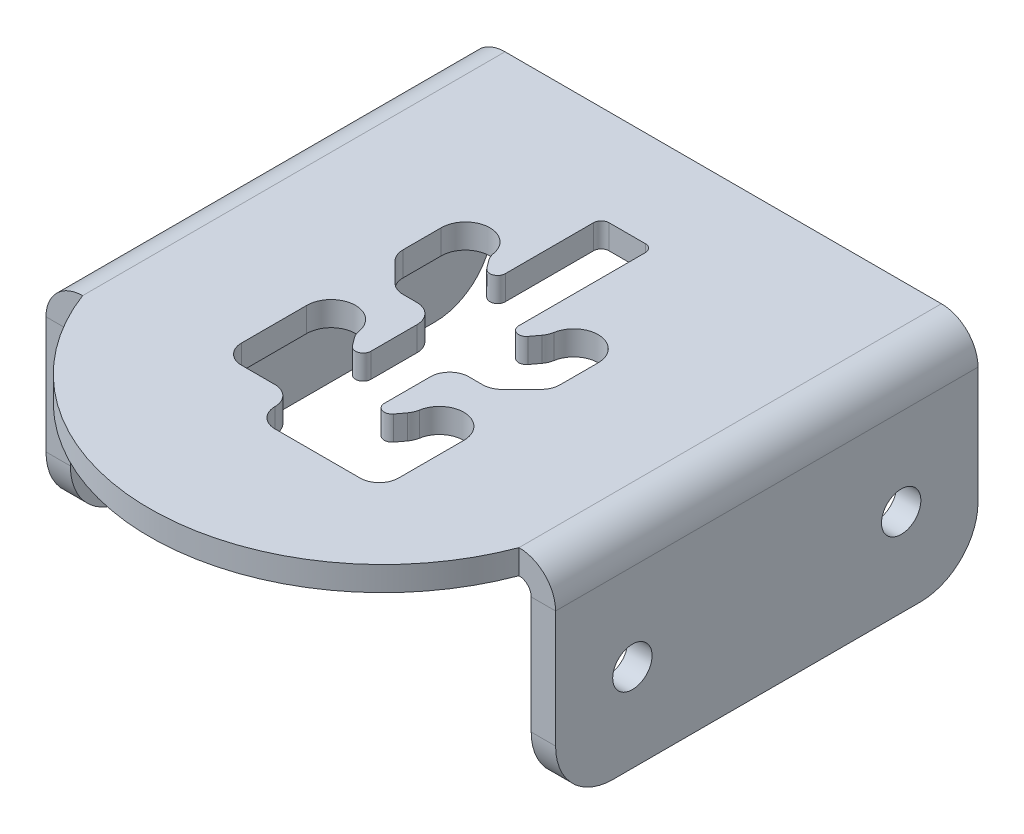
from build123d import *

# Parameters (mm, degrees)
BRIDA_BASE1_DEPTH          = 110
PESTA_A1_DEPTH             = 6.35
CORTAR_EXTRUIR1_REACH      = 205.181
REDONDEO1_R                = 15
CORTAR_EXTRUIR3_DEPTH      = 204.181381454
CORTAR_EXTRUIR3_DEPTH_BACK = 204.181381454
CROQUIS11_R                = 5.125
REDONDEO2_R                = 2
REDONDEO3_R                = 5


# Sheet-metal steps are written as plain solids
with BuildPart() as part:
    # Croquis1 → Brida base1 (new body)
    with BuildSketch(Plane.XY):
        with BuildLine():
            Line((0, 0), (0, 45.47))
            ThreePointArc((0, 45.47), (0.931400436, 47.718599564), (3.18, 48.65))
            Line((3.18, 48.65), (116.82, 48.65))
            ThreePointArc((116.82, 48.65), (119.068599564, 47.718599564), (120, 45.47))
            Line((120, 45.47), (120, 0))
            Line((120, 0), (126.35, 0))
            Line((126.35, 0), (126.35, 45.47))
            ThreePointArc((126.35, 45.47), (123.558727625, 52.208727625), (116.82, 55))
            Line((116.82, 55), (3.18, 55))
            ThreePointArc((3.18, 55), (-3.558727625, 52.208727625), (-6.35, 45.47))
            Line((-6.35, 45.47), (-6.35, 0))
            Line((-6.35, 0), (0, 0))
        make_face()
    extrude(amount=BRIDA_BASE1_DEPTH)

    # Croquis6 → Pestaña1 (add)
    with BuildSketch(Plane(origin=(0, 55, 0), x_dir=(1, 0, 0), z_dir=(0, 1, 0))):
        with BuildLine():
            Line((3.18, -110), (116.82, -110))
            ThreePointArc((116.82, -110), (60, -149.309581975), (3.18, -110))
        make_face()
    extrude(amount=-PESTA_A1_DEPTH)

    # Croquis9 → Cortar-Extruir1 (cut, up to next)
    with BuildSketch(Plane(origin=(0, 55, 0), x_dir=(1, 0, 0), z_dir=(0, 1, 0)), mode=Mode.PRIVATE) as cortar_extruir1_sk1:
        with BuildLine():
            Line((53.25, -115), (85.45, -115))
            Line((85.45, -115), (85.45, -93))
            ThreePointArc((85.45, -93), (79.1, -86.65), (72.75, -93))
            Line((72.75, -93), (66.75, -101))
            Line((66.75, -101), (66.75, -78))
            Line((66.75, -78), (77.45, -78))
            Line((77.45, -78), (85.45, -70))
            Line((85.45, -70), (85.45, -58))
            ThreePointArc((85.45, -58), (79.1, -51.65), (72.75, -58))
            Line((72.75, -58), (66.75, -66))
            Line((66.75, -66), (66.75, -25))
            Line((66.75, -25), (53.25, -25))
            Line((53.25, -25), (53.25, -56))
            Line((53.25, -56), (47.25, -48))
            ThreePointArc((47.25, -48), (40.9, -41.65), (34.55, -48))
            Line((34.55, -48), (34.55, -60))
            Line((34.55, -60), (42.55, -68))
            Line((42.55, -68), (53.25, -68))
            Line((53.25, -68), (53.25, -91))
            Line((53.25, -91), (47.25, -83))
            ThreePointArc((47.25, -83), (40.9, -76.65), (34.55, -83))
            Line((34.55, -83), (34.55, -105))
            Line((34.55, -105), (53.25, -105))
            Line((53.25, -105), (53.25, -115))
        make_face()
    cortar_extruir1_tool1 = extrude(cortar_extruir1_sk1.sketch, amount=-CORTAR_EXTRUIR1_REACH, mode=Mode.PRIVATE) & part.part
    add(cortar_extruir1_tool1.solids().sort_by_distance((60, 55, 76.162835))[0], mode=Mode.SUBTRACT)

    # Redondeo1
    redondeo1_edges = [part.edges().sort_by_distance(p)[0] for p in [
        (-3.175, 0, 0),
        (123.175, 0, 0),
        (-3.175, 0, 110),
        (123.175, 0, 110),
    ]]
    fillet(redondeo1_edges, radius=REDONDEO1_R)

    # Croquis11 → Cortar-Extruir3 (cut, two sides: drawn at the far end of the back side and taken through both)
    with BuildSketch(Plane.ZY.offset(-120).offset(-CORTAR_EXTRUIR3_DEPTH_BACK)):
        with Locations((20.003172622, 22.868986368)):
            Circle(CROQUIS11_R)
        with Locations((90.003172622, 22.868986368)):
            Circle(CROQUIS11_R)
    extrude(amount=CORTAR_EXTRUIR3_DEPTH + CORTAR_EXTRUIR3_DEPTH_BACK, mode=Mode.SUBTRACT)

    # Redondeo2
    redondeo2_edges = [part.edges().sort_by_distance(p)[0] for p in [
        (53.25, 51.825, 56),
        (53.25, 51.825, 25),
        (66.75, 51.825, 25),
        (66.75, 51.825, 66),
        (66.75, 51.825, 101),
        (53.25, 51.825, 91),
    ]]
    fillet(redondeo2_edges, radius=REDONDEO2_R)

    # Redondeo3
    redondeo3_edges = [part.edges().sort_by_distance(p)[0] for p in [
        (34.55, 51.825, 60),
        (47.25, 51.825, 48),
        (72.75, 51.825, 58),
        (85.45, 51.825, 70),
        (77.45, 51.825, 78),
        (66.75, 51.825, 78),
        (72.75, 51.825, 93),
        (85.45, 51.825, 115),
        (53.25, 51.825, 115),
        (53.25, 51.825, 105),
        (34.55, 51.825, 105),
        (47.25, 51.825, 83),
        (53.25, 51.825, 68),
        (42.55, 51.825, 68),
    ]]
    fillet(redondeo3_edges, radius=REDONDEO3_R - 0.0001)  # a hair under: the kernel refuses the full size


solid = part.part
